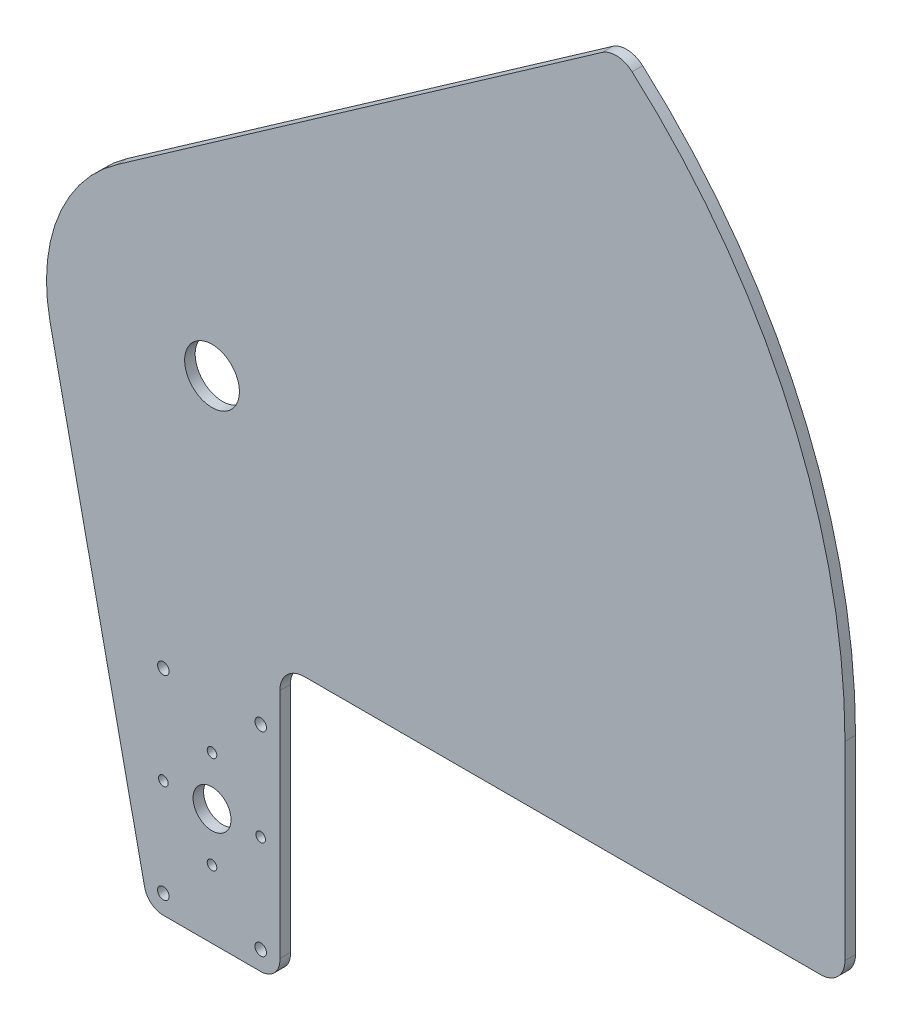
from build123d import *

# Parameters (mm, degrees)
SKETCH1_R               = 86.36
SKETCH1_R_2             = 14.2875
BOSS_EXTRUDE1_DEPTH     = 2.75
SKETCH2_R               = 33.4
SKETCH2_R_2             = 9.906
SKETCH2_R_3             = 2.5
BOSS_EXTRUDE2_DEPTH     = 5.5
FILLET2_R               = 12.7
SKETCH4_R               = 3
BOSS_EXTRUDE3_DEPTH     = 5.5
CUT_EXTRUDE1_DEPTH      = 419.082521041
CUT_EXTRUDE1_DEPTH_BACK = 419.082521041
SKETCH4_3_R             = 3
FILLET3_R               = 12.7


with BuildPart() as part:
    # Sketch1 → Boss-Extrude1 (new, symmetric)
    # profile 1 of 3: a face of its own
    with BuildSketch(Plane.XY):
        Circle(SKETCH1_R)
        Circle(SKETCH1_R_2, mode=Mode.SUBTRACT)
    # profile 2 of 3: a face of its own
    with BuildSketch(Plane.XY):
        with BuildLine():
            Line((0, -86.36), (0, -111.76))
            Line((0, -111.76), (310.711670846, -111.76))
            ThreePointArc((310.711670846, -111.76), (325.291433728, -56.723215206), (330.2, 0))
            ThreePointArc((330.2, 0), (299.066021409, 139.96983546), (211.535222055, 253.544650565))
            Line((211.535222055, 253.544650565), (-49.534061043, 70.741970545))
            ThreePointArc((-49.534061043, 70.741970545), (39.876610239, 76.602255553), (86.36, 0))
            ThreePointArc((86.36, 0), (61.065741623, -61.065741623), (0, -86.36))
        make_face()
    # profile 3 of 3: a face of its own
    with BuildSketch(Plane.XY):
        with BuildLine():
            ThreePointArc((330.2, 0), (325.291433728, -56.723215206), (310.711670846, -111.76))
            Line((310.711670846, -111.76), (330.2, -111.76))
            Line((330.2, -111.76), (330.2, 0))
        make_face()
    extrude(amount=BOSS_EXTRUDE1_DEPTH, both=True)

    # Sketch2 → Boss-Extrude2 (add)
    # profile 1 of 2: a face of its own
    with BuildSketch(Plane.XY.offset(2.75)):
        with BuildLine():
            ThreePointArc((-32.152177301, -204.624196748), (-4.564935824, -162.493426274), (33.4, -195.58))
            Line((33.4, -195.58), (33.4, -111.76))
            Line((33.4, -111.76), (0, -111.76))
            Line((0, -111.76), (0, -86.36))
            ThreePointArc((0, -86.36), (-52.146556012, -68.838842931), (-83.133593763, -23.384935065))
            Line((-83.133593763, -23.384935065), (-32.152177301, -204.624196748))
        make_face()
    # profile 2 of 2: a face of its own
    with BuildSketch(Plane.XY.offset(2.75)):
        with Locations((0, -195.58)):
            Circle(SKETCH2_R)
        with Locations((0, -195.58)):
            Circle(SKETCH2_R_2, mode=Mode.SUBTRACT)
        with Locations((0, -170.18)):
            Circle(SKETCH2_R_3, mode=Mode.SUBTRACT)
        with Locations((25.4, -195.58)):
            Circle(SKETCH2_R_3, mode=Mode.SUBTRACT)
        with Locations((0, -220.98)):
            Circle(SKETCH2_R_3, mode=Mode.SUBTRACT)
        with Locations((-25.4, -195.58)):
            Circle(SKETCH2_R_3, mode=Mode.SUBTRACT)
    extrude(amount=-BOSS_EXTRUDE2_DEPTH)

    # Fillet2
    fillet2_edges = [part.edges().sort_by_distance(p)[0] for p in [
        (211.535222055, 253.544650565, 0),
        (330.2, -111.76, 0),
        (33.4, -111.76, 0),
    ]]
    fillet(fillet2_edges, radius=FILLET2_R)

    # Sketch4 → Boss-Extrude3 (add)
    with BuildSketch(Plane.XY.offset(2.75)):
        with BuildLine():
            ThreePointArc((-83.133593763, -23.384935065), (-83.834442875, -20.732481468), (-84.450685864, -18.05910455))
            Line((-84.450685864, -18.05910455), (-35.178912212, -248.471142259))
            ThreePointArc((-35.178912212, -248.471142259), (-31.688424978, -254.155327086), (-25.4, -256.38))
            Line((-25.4, -256.38), (25.4, -256.38))
            ThreePointArc((25.4, -256.38), (32.743767081, -253.16742109), (35.369047914, -245.593817011))
            Line((35.369047914, -245.593817011), (35.369047914, -117.66760224))
            ThreePointArc((35.369047914, -117.66760224), (33.902190945, -120.923977623), (33.4, -124.46))
            Line((33.4, -124.46), (33.4, -195.58))
            ThreePointArc((33.4, -195.58), (4.564935824, -228.666573726), (-32.152177301, -204.624196748))
            Line((-32.152177301, -204.624196748), (-83.133593763, -23.384935065))
        make_face()
        with Locations((-25.4, -246.38)):
            Circle(SKETCH4_R, mode=Mode.SUBTRACT)
        with Locations((25.4, -246.38)):
            Circle(SKETCH4_R, mode=Mode.SUBTRACT)
    extrude(amount=-BOSS_EXTRUDE3_DEPTH)

    # Sketch4<3> → Cut-Extrude1 (cut, two sides: drawn at the far end of the back side and taken through both)
    with BuildSketch(Plane.XY.offset(2.75).offset(-CUT_EXTRUDE1_DEPTH_BACK)):
        with Locations((-25.4, -144.78)):
            Circle(SKETCH4_3_R)
        with Locations((25.4, -144.78)):
            Circle(SKETCH4_3_R)
    extrude(amount=CUT_EXTRUDE1_DEPTH + CUT_EXTRUDE1_DEPTH_BACK, mode=Mode.SUBTRACT)

    # Fillet3
    # the kernel refuses this fillet: 12.7 mm, written as the material it adds along each edge
    with BuildSketch(Plane(origin=(35.369047914, -117.66760224, 2.75), x_dir=(0.9067040347764744, 0.4217674635626387, 0), z_dir=(0, 0, -1))) as fillet3_piece_1:
        with BuildLine():
            CenterArc((8.650328867, 11.515141242), FILLET3_R, 204.946225236, 90)
            Line((-2.864812375, 6.158694454), (-4.016326499, 5.623049776))
            Line((-4.016326499, 5.623049776), (-1.151514124, -0.535644679))
            Line((-1.151514124, -0.535644679), (-0.686498518, -1.06846609))
            ThreePointArc((-0.686498518, -1.06846609), (12.757076645, -1.981994468), (14.542420333, -1.151514124))
            Line((14.542420333, -1.151514124), (14.006775654, 0))
        make_face()
    extrude(amount=5.5)


solid = part.part
